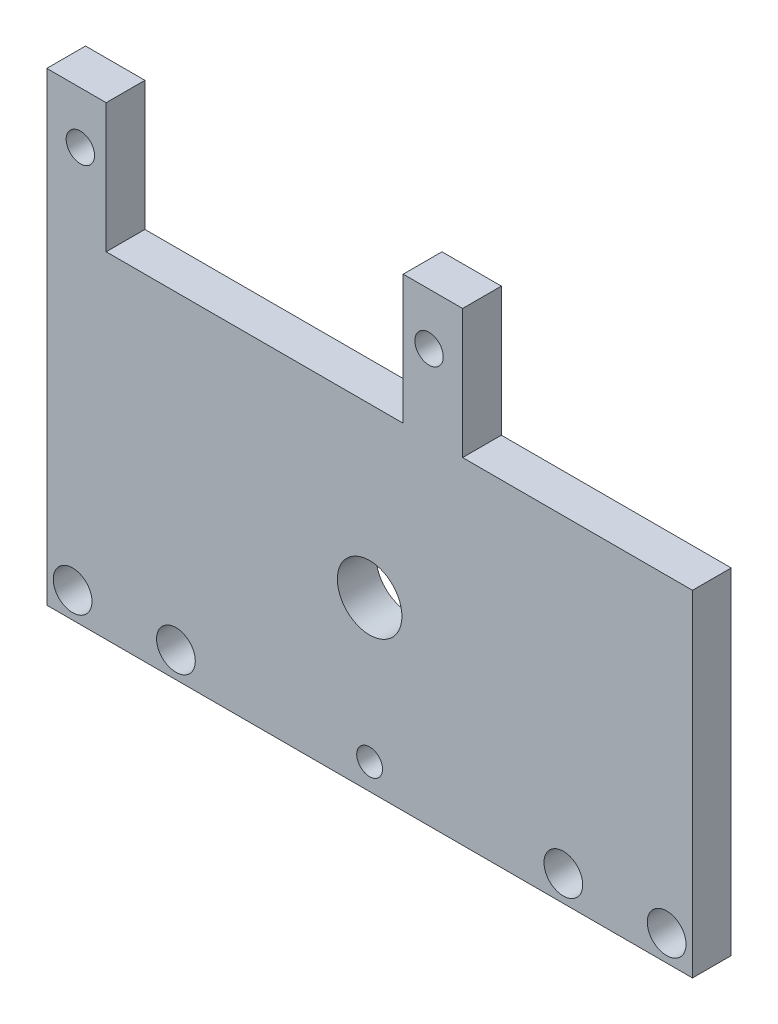
from build123d import *

# Parameters (mm, degrees)
SKETCH_1_R      = 2.5
SKETCH_1_R_2    = 1.1
SKETCH_1_R_3    = 1.5
SKETCH_1_R_4    = 1
EXTRUDE_1_DEPTH = 3


with BuildPart() as part:
    # Эскиз1 → Бобышка-Вытянуть1 (new body)
    with BuildSketch(Plane.XY):
        Polygon((-37.410287044, -18.648677976), (12.589712956, -18.648677976), (12.589712956, 7.351322024), (-5.210287044, 7.351322024), (-5.210287044, 17.351322024), (-9.810287044, 17.351322024), (-9.810287044, 7.351322024), (-32.810287044, 7.351322024), (-32.810287044, 17.351322024), (-37.410287044, 17.351322024), (-37.410287044, 7.351322024), align=None)
        with Locations((-12.410287044, -5.648677976)):
            Circle(SKETCH_1_R, mode=Mode.SUBTRACT)
        with Locations((-34.810287044, 13.351322024)):
            Circle(SKETCH_1_R_2, mode=Mode.SUBTRACT)
        with Locations((-7.810287044, 13.351322024)):
            Circle(SKETCH_1_R_2, mode=Mode.SUBTRACT)
        with Locations((-35.410287044, -16.648677976)):
            Circle(SKETCH_1_R_3, mode=Mode.SUBTRACT)
        with Locations((10.589712956, -16.648677976)):
            Circle(SKETCH_1_R_3, mode=Mode.SUBTRACT)
        with Locations((-12.410287044, -16.648677976)):
            Circle(SKETCH_1_R_4, mode=Mode.SUBTRACT)
        with Locations((-27.410287044, -16.648677976)):
            Circle(SKETCH_1_R_3, mode=Mode.SUBTRACT)
        with Locations((2.589712956, -16.648677976)):
            Circle(SKETCH_1_R_3, mode=Mode.SUBTRACT)
    extrude(amount=EXTRUDE_1_DEPTH)


solid = part.part
